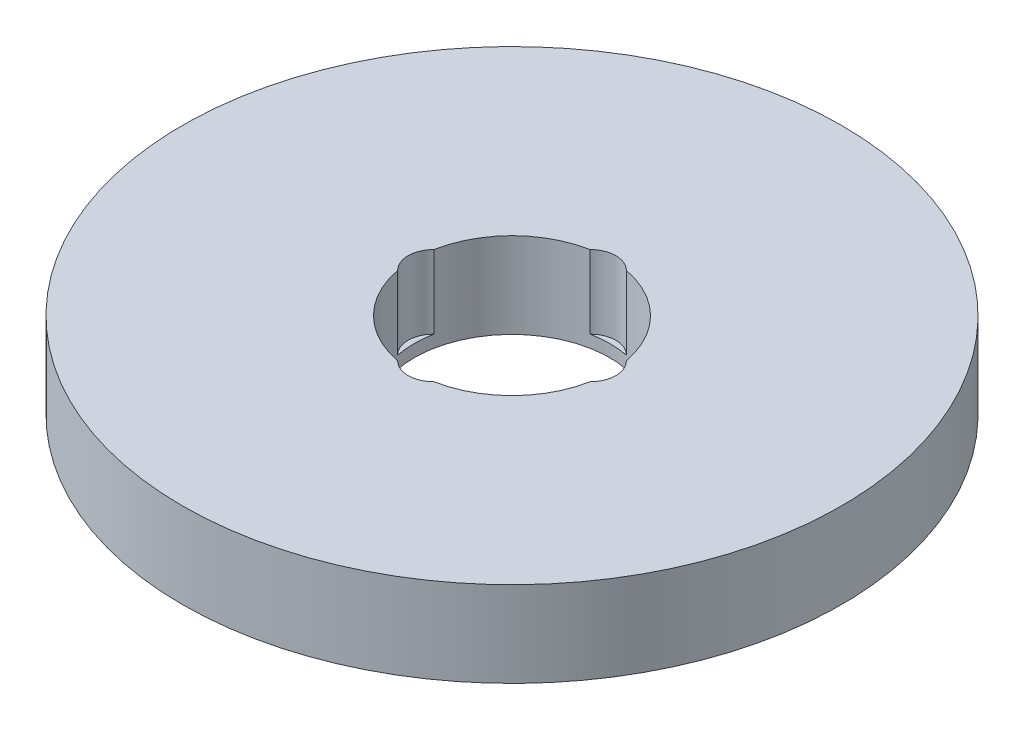
from build123d import *

# Parameters (mm, degrees)
SKETCH1_R           = 92.5
BOSS_EXTRUDE1_DEPTH = 24
SKETCH2_R           = 27.5
CUT_EXTRUDE1_DEPTH  = 133.998120287
SKETCH3_R           = 7.116147283
CUT_EXTRUDE2_DEPTH  = 20.558970345
CIRPATTERN1_COUNT   = 4


with BuildPart() as part:
    # Sketch1 → Boss-Extrude1 (new body)
    with BuildSketch(Plane(origin=(0, 0, 0), x_dir=(1, 0, 0), z_dir=(0, 1, 0))):
        Circle(SKETCH1_R)
    extrude(amount=BOSS_EXTRUDE1_DEPTH)

    # Sketch2 → Cut-Extrude1 (cut, through all)
    with BuildSketch(Plane(origin=(0, 0, 0), x_dir=(1, 0, 0), z_dir=(0, 1, 0))):
        Circle(SKETCH2_R)
    extrude(amount=CUT_EXTRUDE1_DEPTH, mode=Mode.SUBTRACT)

    # Sketch3 → Cut-Extrude2 (cut)
    with BuildSketch(Plane(origin=(0, 24, 0), x_dir=(1, 0, 0), z_dir=(0, 1, 0))):
        with Locations((-22.038404359, 0)):
            Circle(SKETCH3_R)
    cut_extrude2 = extrude(amount=-CUT_EXTRUDE2_DEPTH, mode=Mode.SUBTRACT)

    # CirPattern1: Cut-Extrude2 ×4 about axis
    cirpattern1_axis = Axis((0, 0, 0), (0, 1, 0))
    for i in range(1, CIRPATTERN1_COUNT):
        add(cut_extrude2.rotate(cirpattern1_axis, i * 360 / CIRPATTERN1_COUNT), mode=Mode.SUBTRACT)


solid = part.part
